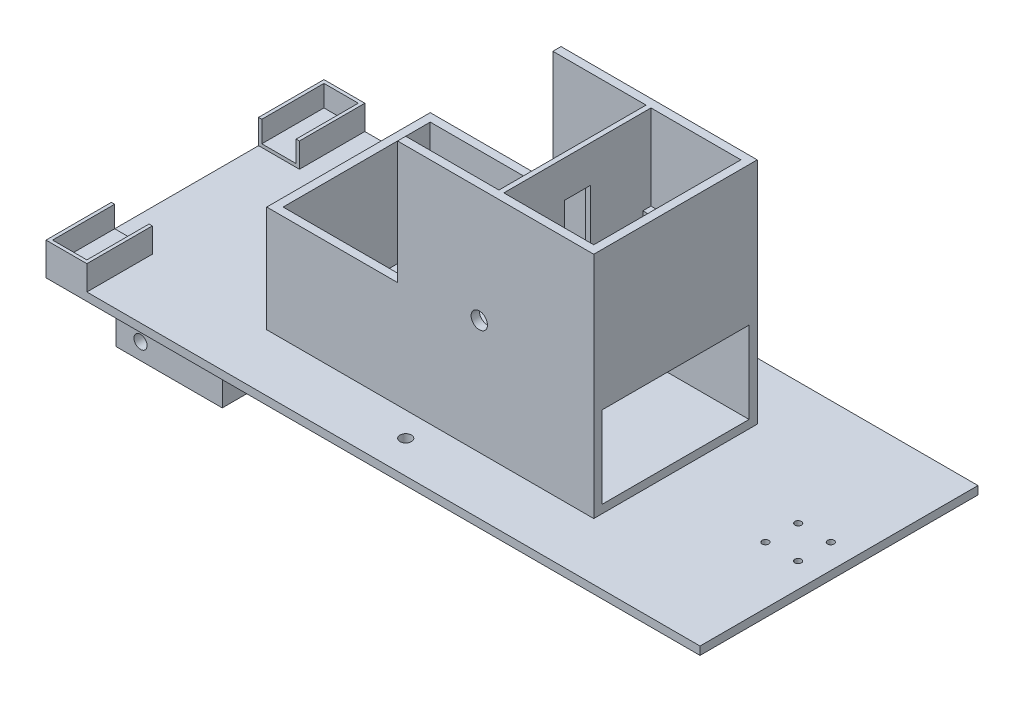
from build123d import *

# Parameters (mm, degrees)
SKETCH1_W                = 400
SKETCH1_H                = 170
BOSS_EXTRUDE1_DEPTH      = 5
SKETCH2_W                = 200
SKETCH2_H                = 100
BOSS_EXTRUDE2_DEPTH      = 140
SHELL1_START             = 5
SHELL1_OUTLINE_W         = 190
SHELL1_OUTLINE_H         = 90
SHELL1_DEPTH             = 140
CUT_EXTRUDE1_DEPTH       = 282.513765205
CUT_EXTRUDE1_DEPTH_BACK  = 282.513765205
SKETCH3_W                = 80
SKETCH3_H                = 75
SKETCH4_R                = 10
CUT_EXTRUDE2_DEPTH       = 140
SKETCH5_W                = 3
SKETCH5_H                = 140
BOSS_EXTRUDE3_DEPTH      = 95
CUT_EXTRUDE3_REACH       = 292.549
SKETCH6_W                = 16
SKETCH6_H                = 95
SKETCH7_R                = 5
CUT_EXTRUDE4_DEPTH       = 140
SKETCH8_W                = 65
SKETCH8_H                = 25
BOSS_EXTRUDE4_DEPTH      = 20
SKETCH9_R                = 2
CUT_EXTRUDE5_DEPTH       = 20
SKETCH21_R               = 3.5
CUT_EXTRUDE9_DEPTH       = 259.505319094
CUT_EXTRUDE10_REACH      = 299.069
SKETCH22_R               = 4
SKETCH35_W               = 90
SKETCH35_H               = 50
CUT_EXTRUDE14_DEPTH      = 15
SKETCH36_W               = 100
SKETCH36_H               = 5
BOSS_EXTRUDE17_DEPTH     = 60
SKETCH38_W               = 25
SKETCH38_H               = 40
BOSS_EXTRUDE19_DEPTH     = 15
CUT_EXTRUDE15_DEPTH      = 128
CUT_EXTRUDE15_DEPTH_BACK = 38
SKETCH39_W               = 21
SKETCH39_H               = 13
SKETCH41_W               = 55
SKETCH41_H               = 3
BOSS_EXTRUDE20_DEPTH     = 10
BOSS_EXTRUDE21_DEPTH     = 30
SKETCH43_W               = 15
SKETCH43_H               = 25
BOSS_EXTRUDE22_DEPTH     = 15
CUT_EXTRUDE16_REACH      = 301.875
SKETCH44_W               = 11
SKETCH44_H               = 11
SKETCH45_R               = 5.5
BOSS_EXTRUDE23_DEPTH     = 25
SKETCH46_R               = 2.5
CUT_EXTRUDE17_DEPTH      = 12


# Read off the part's stored shape, not the designer's step: Shell1
with BuildPart() as part:
    # Sketch1 → Boss-Extrude1 (new body)
    with BuildSketch(Plane(origin=(0, 0, 0), x_dir=(1, 0, 0), z_dir=(0, 1, 0))):
        Rectangle(SKETCH1_W, SKETCH1_H)
    extrude(amount=BOSS_EXTRUDE1_DEPTH)

    # Sketch2 → Boss-Extrude2 (add)
    with BuildSketch(Plane(origin=(0, 5, 0), x_dir=(1, 0, 0), z_dir=(0, 1, 0))):
        Rectangle(SKETCH2_W, SKETCH2_H)
    extrude(amount=BOSS_EXTRUDE2_DEPTH)

    # Shell1 outline → Shell1 (cut)
    with BuildSketch(Plane(origin=(0, 0, 0), x_dir=(1, 0, 0), z_dir=(0, 1, 0)).offset(SHELL1_START)):
        Rectangle(SHELL1_OUTLINE_W, SHELL1_OUTLINE_H)
    extrude(amount=SHELL1_DEPTH, mode=Mode.SUBTRACT)

    # Sketch3 → Cut-Extrude1 (cut, two sides: drawn at the far end of the back side and taken through both)
    with BuildSketch(Plane.XY.offset(50).offset(-CUT_EXTRUDE1_DEPTH_BACK)):
        with Locations((-60, 107.5)):
            Rectangle(SKETCH3_W, SKETCH3_H)
    extrude(amount=CUT_EXTRUDE1_DEPTH + CUT_EXTRUDE1_DEPTH_BACK, mode=Mode.SUBTRACT)

    # Sketch4 → Cut-Extrude2 (cut)
    with BuildSketch(Plane(origin=(0, 5, 0), x_dir=(1, 0, 0), z_dir=(0, 1, 0))):
        with Locations(Location((-40, 0, 0), (0, 0, 270))):
            Circle(SKETCH4_R)
    extrude(amount=-CUT_EXTRUDE2_DEPTH, mode=Mode.SUBTRACT)

    # Sketch5 → Boss-Extrude3 (add)
    with BuildSketch(Plane.XY.offset(50)):
        with Locations((38.5, 75)):
            Rectangle(SKETCH5_W, SKETCH5_H)
    extrude(amount=-BOSS_EXTRUDE3_DEPTH)

    # Sketch6 → Cut-Extrude3 (cut, up to next)
    with BuildSketch(Plane.ZY.offset(-37), mode=Mode.PRIVATE) as cut_extrude3_sk1:
        with Locations((0, 75)):
            Rectangle(SKETCH6_W, SKETCH6_H)
    cut_extrude3_tool1 = extrude(cut_extrude3_sk1.sketch, amount=-CUT_EXTRUDE3_REACH, mode=Mode.PRIVATE) & part.part
    add(cut_extrude3_tool1.solids().sort_by_distance((37, 75, 0))[0], mode=Mode.SUBTRACT)

    # Sketch7 → Cut-Extrude4 (cut)
    with BuildSketch(Plane.XY.offset(50)):
        with Locations((30, 75)):
            Circle(SKETCH7_R)
    extrude(amount=-CUT_EXTRUDE4_DEPTH, mode=Mode.SUBTRACT)

    # Sketch8 → Boss-Extrude4 (add)
    with BuildSketch(Plane.XZ):
        with Locations((-129.700529479, 67.5)):
            Rectangle(SKETCH8_W, SKETCH8_H)
    boss_extrude4 = extrude(amount=BOSS_EXTRUDE4_DEPTH)

    # Mirror1: Boss-Extrude4 across plane
    add(boss_extrude4.mirror(Plane.XY))

    # Sketch9 → Cut-Extrude5 (cut)
    with BuildSketch(Plane(origin=(0, 5, 0), x_dir=(1, 0, 0), z_dir=(0, 1, 0))):
        with Locations(Location((185, 10, 0), (0, 0, 270))):
            Circle(SKETCH9_R)
        with Locations(Location((185, -10, 0), (0, 0, 270))):
            Circle(SKETCH9_R)
        with Locations(Location((165, -10, 0), (0, 0, 270))):
            Circle(SKETCH9_R)
        with Locations(Location((165, 10, 0), (0, 0, 270))):
            Circle(SKETCH9_R)
    extrude(amount=-CUT_EXTRUDE5_DEPTH, mode=Mode.SUBTRACT)

    # Sketch21 → Cut-Extrude9 (cut, through all)
    with BuildSketch(Plane(origin=(0, 5, 0), x_dir=(1, 0, 0), z_dir=(0, 1, 0))):
        with Locations(Location((0, 65, 0), (0, 0, 270))):
            Circle(SKETCH21_R)
        with Locations(Location((0, -65, 0), (0, 0, 270))):
            Circle(SKETCH21_R)
    extrude(amount=-CUT_EXTRUDE9_DEPTH, mode=Mode.SUBTRACT)

    # Cut-Extrude10: up to this face of the body (flat: up to its plane)
    cut_extrude10_end = Plane(part.part.faces().sort_by_distance((-129.700529479, -10, -80))[0])
    # Sketch22 → Cut-Extrude10 (cut, up to the picked face)
    with BuildSketch(Plane.XY.offset(80), mode=Mode.PRIVATE) as cut_extrude10_sk1:
        with Locations((-147.200529479, -10)):
            Circle(SKETCH22_R)
    cut_extrude10_tool1 = split(extrude(cut_extrude10_sk1.sketch, amount=-CUT_EXTRUDE10_REACH, mode=Mode.PRIVATE), bisect_by=cut_extrude10_end, keep=Keep.BOTH, mode=Mode.PRIVATE)
    add(cut_extrude10_tool1.solids().sort_by(Axis((-147.200529, -10, 80), (0, 0, -1)))[0], mode=Mode.SUBTRACT)

    # Sketch35 → Cut-Extrude14 (cut)
    with BuildSketch(Plane(origin=(100, 0, 0), x_dir=(0, 0, -1), z_dir=(1, 0, 0))):
        with Locations((0, 35)):
            Rectangle(SKETCH35_W, SKETCH35_H)
    extrude(amount=-CUT_EXTRUDE14_DEPTH, mode=Mode.SUBTRACT)

    # Sketch36 → Boss-Extrude17 (add)
    with BuildSketch(Plane(origin=(100, 0, 0), x_dir=(0, 0, -1), z_dir=(1, 0, 0))):
        with Locations((0, 7.5)):
            Rectangle(SKETCH36_W, SKETCH36_H)
    extrude(amount=-BOSS_EXTRUDE17_DEPTH)

    # Sketch38 → Boss-Extrude19 (add)
    with BuildSketch(Plane(origin=(0, 5, 0), x_dir=(1, 0, 0), z_dir=(0, 1, 0))):
        with Locations((-187.5, 65)):
            Rectangle(SKETCH38_W, SKETCH38_H)
        with Locations((-187.5, -65)):
            Rectangle(SKETCH38_W, SKETCH38_H)
    extrude(amount=BOSS_EXTRUDE19_DEPTH)

    # Sketch39 → Cut-Extrude15 (cut, two sides: drawn at the far end of the back side and taken through both)
    with BuildSketch(Plane.XY.offset(-45).offset(-CUT_EXTRUDE15_DEPTH_BACK)):
        with Locations((-187.5, 13.5)):
            Rectangle(SKETCH39_W, SKETCH39_H)
    extrude(amount=CUT_EXTRUDE15_DEPTH + CUT_EXTRUDE15_DEPTH_BACK, mode=Mode.SUBTRACT)

    # Sketch41 → Boss-Extrude20 (add)
    with BuildSketch(Plane.XY.offset(50)):
        with Locations((67.5, 91.5)):
            Rectangle(SKETCH41_W, SKETCH41_H)
    boss_extrude20 = extrude(amount=-BOSS_EXTRUDE20_DEPTH)

    # Mirror2: Boss-Extrude20 across plane
    add(boss_extrude20.mirror(Plane.XY))

    # Sketch42 → Boss-Extrude21 (add)
    with BuildSketch(Plane.XZ):
        Polygon((-22.615245333, 28.335945479), (2.686498042, 12.216957229), (0, 8), (-25.301743374, 24.11898825), align=None)
        Polygon((2.686498042, -12.216957229), (-22.615245333, -28.335945479), (-25.301743374, -24.11898825), (0, -8), align=None)
    extrude(amount=BOSS_EXTRUDE21_DEPTH)

    # Sketch43 → Boss-Extrude22 (add)
    with BuildSketch(Plane.XZ):
        with Locations((93.585171048, -72.5)):
            Rectangle(SKETCH43_W, SKETCH43_H)
    extrude(amount=BOSS_EXTRUDE22_DEPTH)

    # Sketch44 → Cut-Extrude16 (cut, up to next)
    with BuildSketch(Plane(origin=(0, 0, -85), x_dir=(-1, 0, 0), z_dir=(0, 0, -1)), mode=Mode.PRIVATE) as cut_extrude16_sk1:
        with Locations((-93.585171048, -7.5)):
            Rectangle(SKETCH44_W, SKETCH44_H)
    cut_extrude16_tool1 = extrude(cut_extrude16_sk1.sketch, amount=-CUT_EXTRUDE16_REACH, mode=Mode.PRIVATE) & part.part
    add(cut_extrude16_tool1.solids().sort_by_distance((93.585171, -7.5, -85))[0], mode=Mode.SUBTRACT)


with BuildPart() as body_2:
    # Sketch45 → Boss-Extrude23 (new body)
    with BuildSketch(Plane(origin=(0, 0, -85), x_dir=(-1, 0, 0), z_dir=(0, 0, -1))):
        with Locations((-93.585171048, -7.5)):
            Circle(SKETCH45_R)
    extrude(amount=-BOSS_EXTRUDE23_DEPTH)

    # Sketch46 → Cut-Extrude17 (cut)
    with BuildSketch(Plane(origin=(0, 0, -85), x_dir=(-1, 0, 0), z_dir=(0, 0, -1))):
        with Locations((-93.585171048, -7.5)):
            Circle(SKETCH46_R)
    extrude(amount=-CUT_EXTRUDE17_DEPTH, mode=Mode.SUBTRACT)


solid = Compound([part.part, body_2.part])
